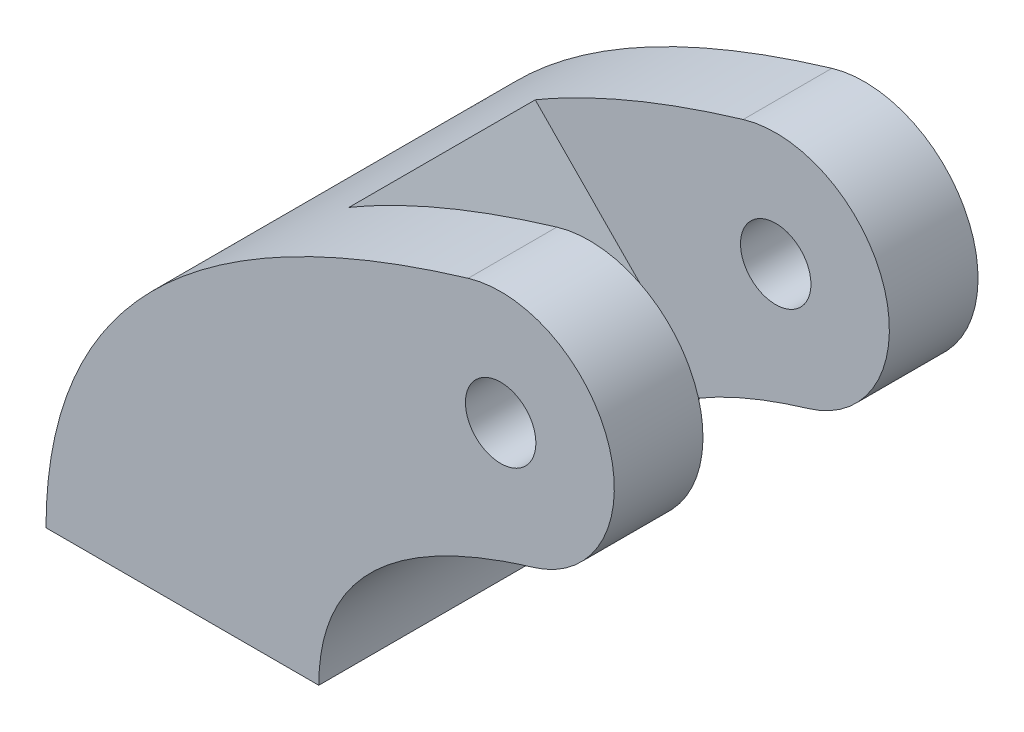
from build123d import *

# Parameters (mm, degrees)
SKETCH1_R           = 1.55
BOSS_EXTRUDE1_DEPTH = 8
CUT_EXTRUDE1_DEPTH  = 4.1
CHAMFER1_START      = -4.1
CHAMFER1_DEPTH      = 8.2


with BuildPart() as part:
    # Sketch1 → Boss-Extrude1 (new, symmetric)
    with BuildSketch(Plane.XY):
        with BuildLine():
            Line((-20, -14), (-8, -14))
            add(Edge.make_bspline(
                [(1.429165494, -4.791397081), (-8, -7.603904107), (-8, -14)],
                knots=[0, 0, 0, 1, 1, 1], degree=2))
            ThreePointArc((1.429165494, -4.791397081), (4.791397081, 1.429165494), (-1.429165494, 4.791397081))
            add(Edge.make_bspline(
                [(-1.429165494, 4.791397081), (-20, -0.747863266), (-20, -14)],
                knots=[0, 0, 0, 1, 1, 1], degree=2))
        make_face()
        Circle(SKETCH1_R, mode=Mode.SUBTRACT)
    extrude(amount=BOSS_EXTRUDE1_DEPTH, both=True)

    # Sketch2 → Cut-Extrude1 (cut, symmetric)
    with BuildSketch(Plane.XY):
        with BuildLine():
            Line((-4.097628997, -7.253626281), (-7.078971892, 2.741575612))
            add(Edge.make_bspline(
                [(-1.429165494, 4.791397081), (-4.509542465, 3.872590228), (-7.078971892, 2.741575612)],
                knots=[0, 0, 0, 1, 1, 1], degree=2))
            ThreePointArc((-1.429165494, 4.791397081), (4.791397081, 1.429165494), (1.429165494, -4.791397081))
            add(Edge.make_bspline(
                [(-4.097628997, -7.253626281), (-1.934020936, -5.794559606), (1.429165494, -4.791397081)],
                knots=[0, 0, 0, 1, 1, 1], degree=2))
        make_face()
    extrude(amount=CUT_EXTRUDE1_DEPTH, both=True, mode=Mode.SUBTRACT)

    # Chamfer1: read off the stored shape, not the designer's step
    # Chamfer1 outline → Chamfer1 (cut)
    with BuildSketch(Plane.XY.offset(CHAMFER1_START)):
        with BuildLine():
            Line((-10.578223544, 0.965390038), (-4.792307112, -4.924659687))
            Line((-4.792307112, -4.924659687), (-7.078971892, 2.741575612))
            add(Edge.make_bspline(
                [(-7.078971892, 2.741575612), (-8.966458483, 1.910739435), (-10.578223544, 0.965390038)],
                knots=[0.165871758, 0.165871758, 0.165871758, 0.287720102, 0.287720102, 0.287720102], degree=2))
        make_face()
    extrude(amount=CHAMFER1_DEPTH, mode=Mode.SUBTRACT)


solid = part.part
